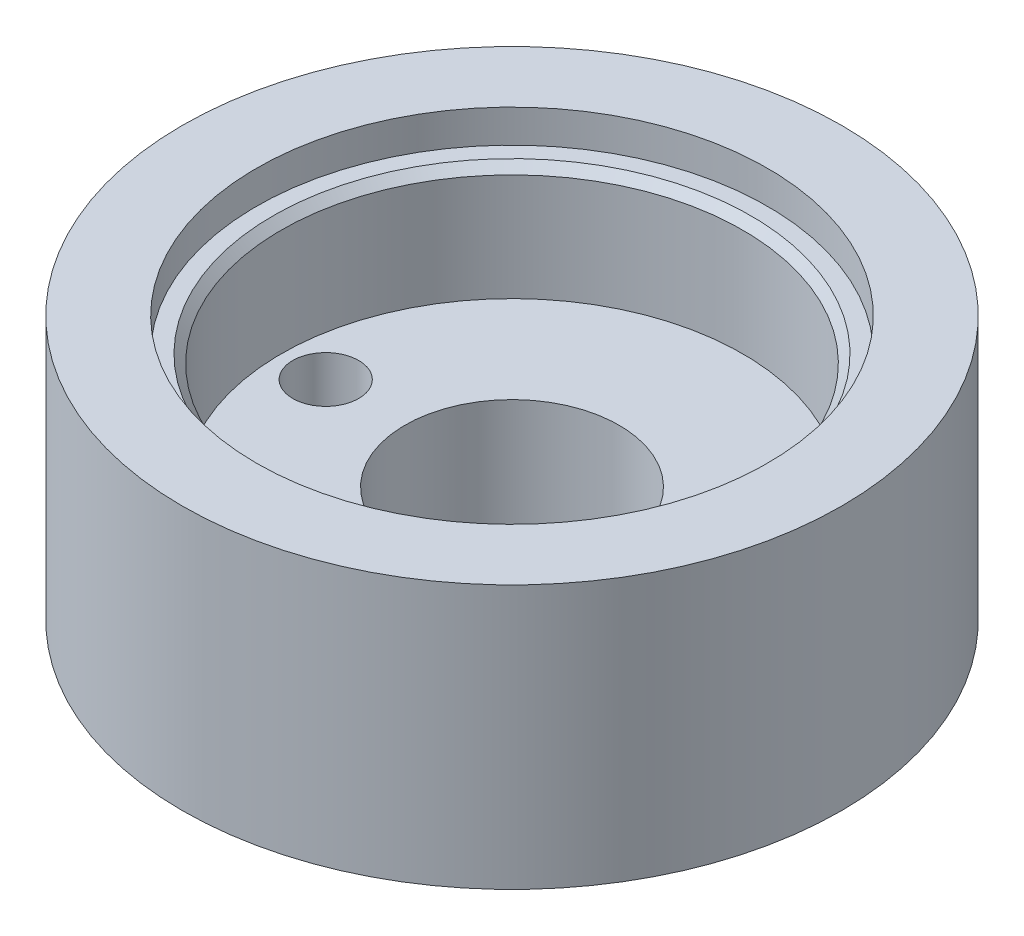
from build123d import *

# Parameters (mm, degrees)
SKETCH1_R               = 15.875
BOSS_EXTRUDE1_DEPTH     = 12.7
F_3_8_CLEARANCE_HOLE1_D = 10.31748
CUT_EXTRUDE1_DEPTH      = 26.793821935
CUT_EXTRUDE1_DEPTH_BACK = 26.793821935
SKETCH4_R               = 1.5875


with BuildPart() as part:
    # Sketch1 → Boss-Extrude1 (new body)
    with BuildSketch(Plane(origin=(0, 0, 0), x_dir=(1, 0, 0), z_dir=(0, 1, 0))):
        with Locations(Location((0, 0, 0), (0, 0, 270))):
            Circle(SKETCH1_R)
    extrude(amount=BOSS_EXTRUDE1_DEPTH)

    # 3/8 Clearance Hole1 (through all)
    with Locations(Plane(origin=(0, 12.7, 0), x_dir=(1, 0, 0), z_dir=(0, 1, 0))):
        with Locations((0, 0)):
            Hole(F_3_8_CLEARANCE_HOLE1_D / 2)


with BuildPart() as body_2:
    # uxcell-FR6ZZ: read off the stored shape, not the designer's step
    # uxcell-FR6ZZ outline → uxcell-FR6ZZ (revolve)
    with BuildSketch(Plane(origin=(-41.000177455, 0, 16.423895222), x_dir=(1, 0, 0), z_dir=(0, 0, 1))):
        Polygon((12.303125, 21.164419461), (4.7625, 21.164419461), (4.7625, 14.020669461), (11.1125, 14.020669461), (11.1125, 19.180044461), (11.509375, 19.576919461), (12.303125, 19.576919461), align=None)
    revolve(axis=Axis((-41.000177455, 0, 16.423895222), (0, 1, 0)))


with BuildPart() as body_2_1:
    # Body-Move/Copy2: read off the stored shape, not the designer's step
    # Body-Move/Copy2: moved
    add(body_2.part.moved(Location((41.0001775, -8.4644195, -16.4238952))))


with BuildPart() as part_1:
    add(part.part)

    # Combine1: cut body 2
    add(body_2_1.part, mode=Mode.SUBTRACT)

    # Sketch4 → Cut-Extrude1 (cut, two sides: drawn at the far end of the back side and taken through both)
    with BuildSketch(Plane(origin=(0, 0, 0), x_dir=(1, 0, 0), z_dir=(0, 1, 0)).offset(-CUT_EXTRUDE1_DEPTH_BACK)):
        with Locations(Location((-8.96874, 0, 0), (0, 0, 270))):
            Circle(SKETCH4_R)
        with Locations(Location((8.96874, 0, 0), (0, 0, 270))):
            Circle(SKETCH4_R)
    extrude(amount=CUT_EXTRUDE1_DEPTH + CUT_EXTRUDE1_DEPTH_BACK, mode=Mode.SUBTRACT)


solid = part_1.part
